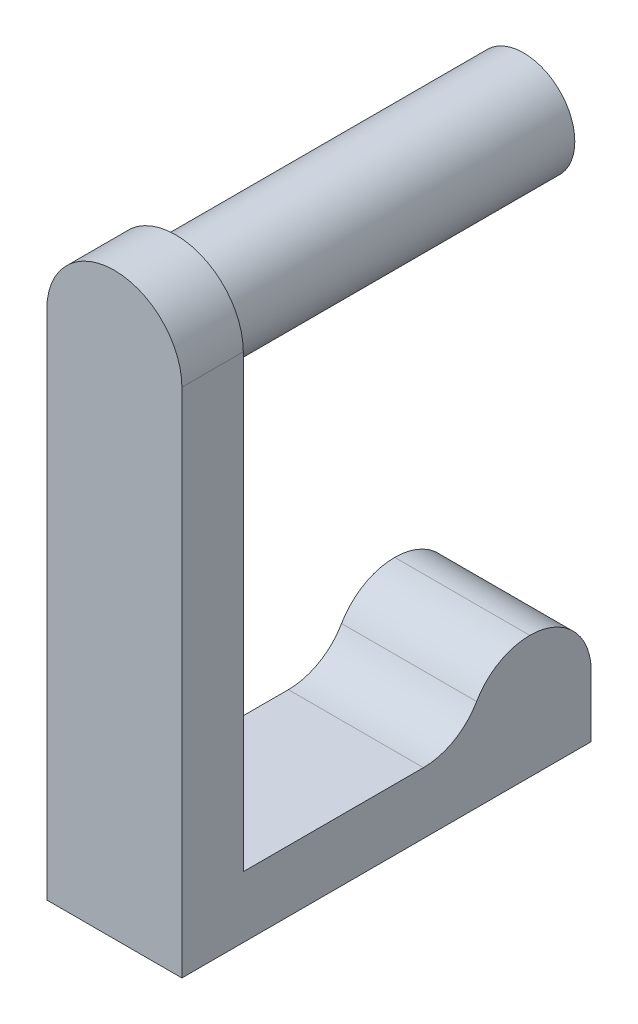
from build123d import *

# Parameters (mm, degrees)
SKETCH1_R           = 2.5
BOSS_EXTRUDE1_DEPTH = 17
SKETCH2_R           = 2.5
BOSS_EXTRUDE2_DEPTH = 3
SKETCH3_W           = 6.6
SKETCH3_H           = 3
BOSS_EXTRUDE3_DEPTH = 17
SKETCH4_W           = 6.6
SKETCH4_H           = 6
BOSS_EXTRUDE4_DEPTH = 3
FILLET1_R           = 3
FILLET2_R           = 3
FILLET3_R           = 3


with BuildPart() as part:
    # Sketch1 → Boss-Extrude1 (new body)
    with BuildSketch(Plane.XY):
        with Locations((-6.241397348, 9.343721229)):
            Circle(SKETCH1_R)
    extrude(amount=-BOSS_EXTRUDE1_DEPTH)


with BuildPart() as body_2:
    # Sketch2 → Boss-Extrude2 (new body)
    with BuildSketch(Plane.XY):
        with BuildLine():
            ThreePointArc((-8.741397348, 9.343721229), (-6.241397348, 11.843721229), (-3.741397348, 9.343721229))
            Line((-3.741397348, 9.343721229), (-2.941397348, 9.343721229))
            ThreePointArc((-2.941397348, 9.343721229), (-6.241397348, 12.643721229), (-9.541397348, 9.343721229))
            Line((-9.541397348, 9.343721229), (-8.741397348, 9.343721229))
        make_face()
        with BuildLine():
            Line((-2.941397348, 9.343721229), (-3.741397348, 9.343721229))
            ThreePointArc((-3.741397348, 9.343721229), (-6.241397348, 6.843721229), (-8.741397348, 9.343721229))
            Line((-8.741397348, 9.343721229), (-9.541397348, 9.343721229))
            ThreePointArc((-9.541397348, 9.343721229), (-6.241397348, 6.043721229), (-2.941397348, 9.343721229))
        make_face()
        with BuildLine():
            Line((-2.941397348, -15.656278771), (-2.941397348, 9.343721229))
            ThreePointArc((-2.941397348, 9.343721229), (-6.241397348, 6.043721229), (-9.541397348, 9.343721229))
            Line((-9.541397348, 9.343721229), (-9.541397348, -15.656278771))
            Line((-9.541397348, -15.656278771), (-2.941397348, -15.656278771))
        make_face()
        with Locations((-6.241397348, 9.343721229)):
            Circle(SKETCH2_R)
    extrude(amount=BOSS_EXTRUDE2_DEPTH)

    # Sketch3 → Boss-Extrude3 (add)
    with BuildSketch(Plane(origin=(0, 0, 0), x_dir=(-1, 0, 0), z_dir=(0, 0, -1))):
        with Locations((6.241397348, -14.156278771)):
            Rectangle(SKETCH3_W, SKETCH3_H)
    extrude(amount=BOSS_EXTRUDE3_DEPTH)

    # Sketch4 → Boss-Extrude4 (add)
    with BuildSketch(Plane(origin=(0, -12.656278771, 0), x_dir=(1, 0, 0), z_dir=(0, 1, 0))):
        with Locations((-6.241397348, 14)):
            Rectangle(SKETCH4_W, SKETCH4_H)
    extrude(amount=BOSS_EXTRUDE4_DEPTH)

    # Fillet1
    fillet1_edges = [body_2.edges().sort_by_distance(p)[0] for p in [
        (-6.241397348, -9.656278771, -11),
    ]]
    fillet(fillet1_edges, radius=FILLET1_R - 0.0001)  # a hair under: the kernel refuses the full size

    # Fillet2
    fillet2_edges = [body_2.edges().sort_by_distance(p)[0] for p in [
        (-6.241397348, -12.656278771, -11),
    ]]
    fillet(fillet2_edges, radius=FILLET2_R)

    # Fillet3
    fillet3_edges = [body_2.edges().sort_by_distance(p)[0] for p in [
        (-6.241397348, -9.656278771, -17),
    ]]
    fillet(fillet3_edges, radius=FILLET3_R)


solid = Compound([part.part, body_2.part])
